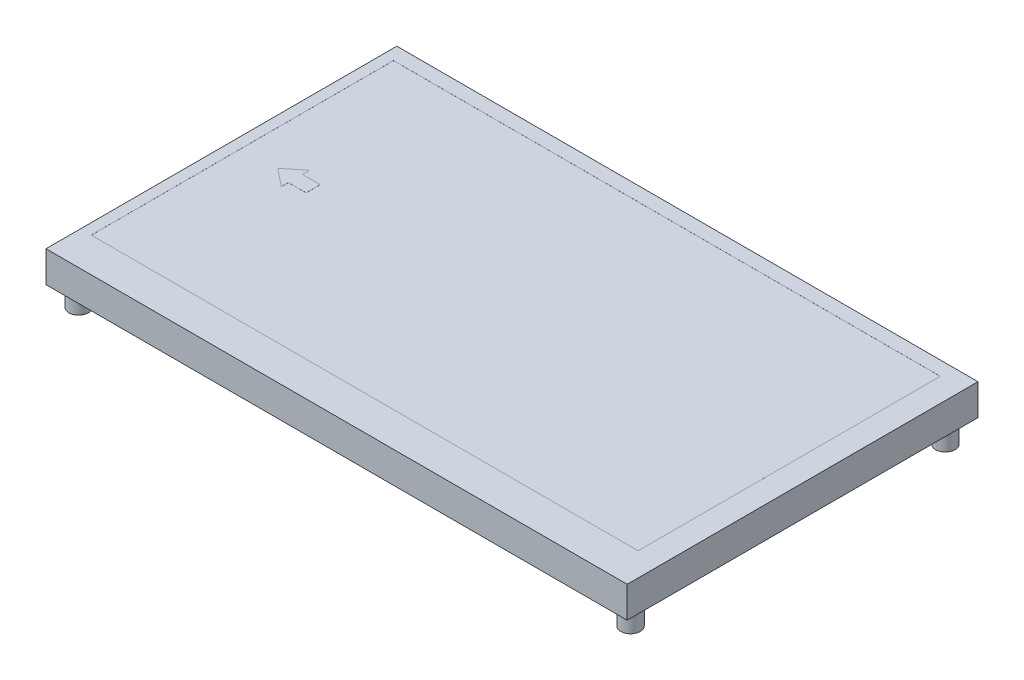
from build123d import *

# Parameters (mm, degrees)
SKETCH1_W           = 164.28
SKETCH1_H           = 99.17
BOSS_EXTRUDE1_DEPTH = 8.8
SKETCH2_R           = 2.75
SKETCH2_R_2         = 1.25
BOSS_EXTRUDE2_DEPTH = 6
SKETCH3_W           = 154.57
SKETCH3_H           = 85.44
CUT_EXTRUDE1_DEPTH  = 0.01
BOSS_EXTRUDE3_DEPTH = 7.3
SKETCH5_W           = 3.8
SKETCH5_H           = 3
BOSS_EXTRUDE4_DEPTH = 1.2


with BuildPart() as part:
    # Sketch1 → Boss-Extrude1 (new body)
    with BuildSketch(Plane(origin=(0, 0, 0), x_dir=(1, 0, 0), z_dir=(0, 1, 0))):
        Rectangle(SKETCH1_W, SKETCH1_H)
    extrude(amount=BOSS_EXTRUDE1_DEPTH)

    # Sketch2 → Boss-Extrude2 (add)
    # profile 1 of 4: a face of its own
    with BuildSketch(Plane.XZ):
        with Locations((-78, 44.5)):
            Circle(SKETCH2_R)
        with Locations((-78, 44.5)):
            Circle(SKETCH2_R_2, mode=Mode.SUBTRACT)
    # profile 2 of 4: a face of its own
    with BuildSketch(Plane.XZ):
        with Locations((78, 44.5)):
            Circle(SKETCH2_R)
        with Locations((78, 44.5)):
            Circle(SKETCH2_R_2, mode=Mode.SUBTRACT)
    # profile 3 of 4: a face of its own
    with BuildSketch(Plane.XZ):
        with Locations((78, -44.5)):
            Circle(SKETCH2_R)
        with Locations((78, -44.5)):
            Circle(SKETCH2_R_2, mode=Mode.SUBTRACT)
    # profile 4 of 4: a face of its own
    with BuildSketch(Plane.XZ):
        with Locations((-78, -44.5)):
            Circle(SKETCH2_R)
        with Locations((-78, -44.5)):
            Circle(SKETCH2_R_2, mode=Mode.SUBTRACT)
    extrude(amount=BOSS_EXTRUDE2_DEPTH)

    # Sketch3 → Cut-Extrude1 (cut)
    with BuildSketch(Plane(origin=(0, 8.8, 0), x_dir=(1, 0, 0), z_dir=(0, 1, 0))):
        with Locations((-1.795, 2.865)):
            Rectangle(SKETCH3_W, SKETCH3_H)
        Polygon((-64.08, 0.865), (-64.08, -1.135), (-69.08, 2.865), (-64.08, 6.865), (-64.08, 4.865), (-59.08, 4.865), (-59.08, 0.865), align=None, mode=Mode.SUBTRACT)
    extrude(amount=-CUT_EXTRUDE1_DEPTH, mode=Mode.SUBTRACT)

    # Sketch5 → Boss-Extrude4 (add)
    with BuildSketch(Plane.XZ):
        with Locations((-68, 46)):
            Rectangle(SKETCH5_W, SKETCH5_H)
        with Locations((68, 46)):
            Rectangle(SKETCH5_W, SKETCH5_H)
    extrude(amount=BOSS_EXTRUDE4_DEPTH)


with BuildPart() as body_2:
    # Sketch4 → Boss-Extrude3 (new body)
    with BuildSketch(Plane.ZY.offset(82.14)):
        with BuildLine():
            Line((31.685, -0.01), (37.585, -0.01))
            ThreePointArc((37.585, -0.01), (39.085, -1.51), (37.585, -3.01))
            Line((37.585, -3.01), (31.685, -3.01))
            ThreePointArc((31.685, -3.01), (30.185, -1.51), (31.685, -0.01))
        make_face()
        with BuildLine():
            Line((31.685, -0.16), (37.585, -0.16))
            ThreePointArc((37.585, -0.16), (38.935, -1.51), (37.585, -2.86))
            Line((37.585, -2.86), (31.685, -2.86))
            ThreePointArc((31.685, -2.86), (30.335, -1.51), (31.685, -0.16))
        make_face(mode=Mode.SUBTRACT)
    extrude(amount=-BOSS_EXTRUDE3_DEPTH)


solid = Compound([part.part, body_2.part])
